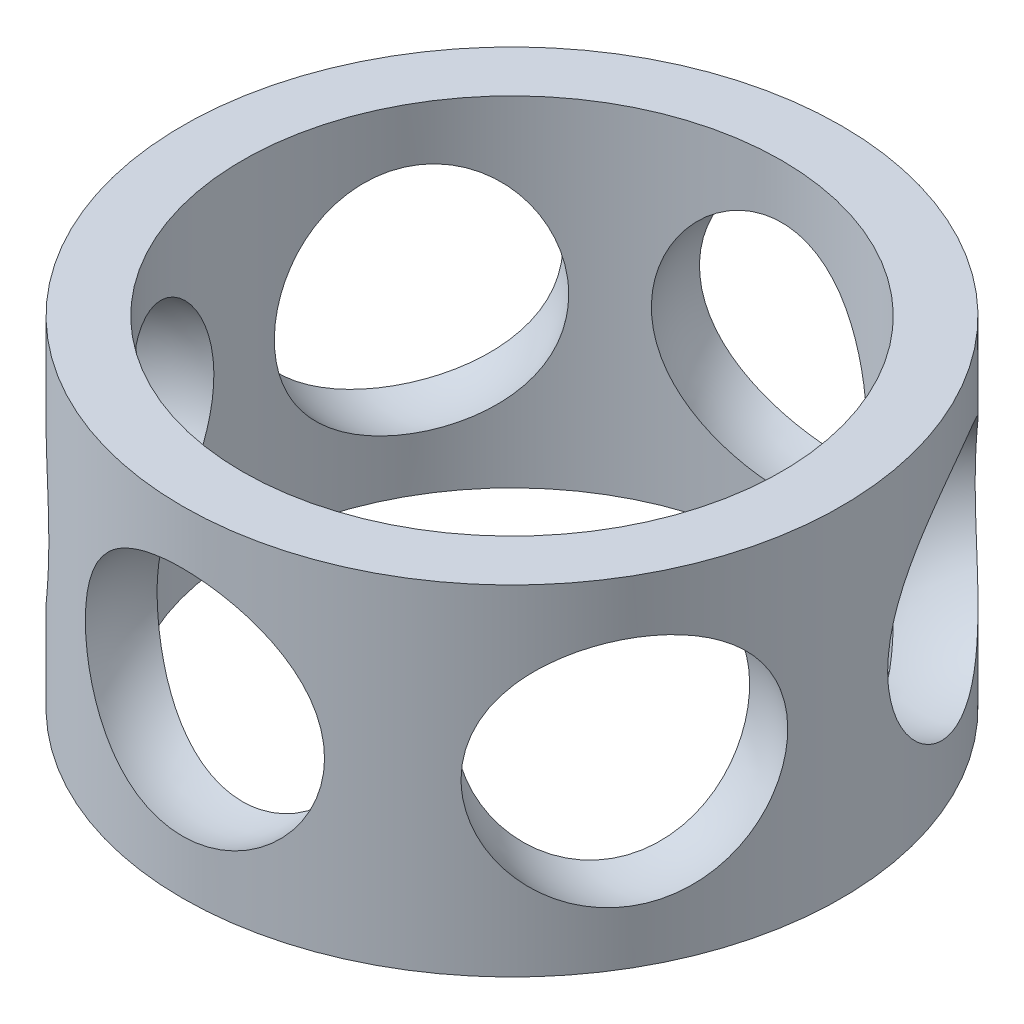
from build123d import *

# Parameters (mm, degrees)
BOSS_EXTRUDE1_DEPTH      = 1.7
BOSS_EXTRUDE1_DEPTH_BACK = 1.7
SKETCH1_R                = 3.3
SKETCH1_R_2              = 2.7
CIRPATTERN1_COUNT        = 6


with BuildPart() as part:
    # Sketch1 → Boss-Extrude1 (new, two sides: drawn at the far end of the back side and taken through both)
    with BuildSketch(Plane(origin=(0, 0, 0), x_dir=(1, 0, 0), z_dir=(0, 1, 0)).offset(-BOSS_EXTRUDE1_DEPTH_BACK)):
        with Locations(Location((0, 0, 0), (0, 0, 270))):
            Circle(SKETCH1_R)
        with Locations(Location((0, 0, 0), (0, 0, 270))):
            Circle(SKETCH1_R_2, mode=Mode.SUBTRACT)
    extrude(amount=BOSS_EXTRUDE1_DEPTH + BOSS_EXTRUDE1_DEPTH_BACK)


with BuildPart() as body_2:
    # Sketch2 → Revolve1 (revolve)
    with BuildSketch(Plane(origin=(0, 0, 0), x_dir=(1, 0, 0), z_dir=(0, 1, 0))):
        with BuildLine():
            Line((0, 4.2), (0, 1.8))
            ThreePointArc((0, 1.8), (1.2, 3), (0, 4.2))
        make_face()
    revolve(axis=Axis((0, 0, -3.3), (0, 0, 1)))


with BuildPart() as cirpattern1_1:
    # CirPattern1: pattern copy
    add(body_2.part.rotate(Axis((0, 0, 0), (0, 1, 0)), 1 * 360 / CIRPATTERN1_COUNT))


with BuildPart() as cirpattern1_2:
    # CirPattern1: pattern copy
    add(body_2.part.rotate(Axis((0, 0, 0), (0, 1, 0)), 2 * 360 / CIRPATTERN1_COUNT))


with BuildPart() as cirpattern1_3:
    # CirPattern1: pattern copy
    add(body_2.part.rotate(Axis((0, 0, 0), (0, 1, 0)), 3 * 360 / CIRPATTERN1_COUNT))


with BuildPart() as cirpattern1_4:
    # CirPattern1: pattern copy
    add(body_2.part.rotate(Axis((0, 0, 0), (0, 1, 0)), 4 * 360 / CIRPATTERN1_COUNT))


with BuildPart() as cirpattern1_5:
    # CirPattern1: pattern copy
    add(body_2.part.rotate(Axis((0, 0, 0), (0, 1, 0)), 5 * 360 / CIRPATTERN1_COUNT))


with BuildPart() as part_1:
    add(part.part)

    # Combine1: read off the stored shape, not the designer's step
    # Combine1: cut CirPattern1_1, CirPattern1_2, CirPattern1_3, CirPattern1_4, CirPattern1_5, body 2
    add(cirpattern1_1.part, mode=Mode.SUBTRACT)
    add(cirpattern1_2.part, mode=Mode.SUBTRACT)
    add(cirpattern1_3.part, mode=Mode.SUBTRACT)
    add(cirpattern1_4.part, mode=Mode.SUBTRACT)
    add(cirpattern1_5.part, mode=Mode.SUBTRACT)
    add(body_2.part, mode=Mode.SUBTRACT)


solid = part_1.part
